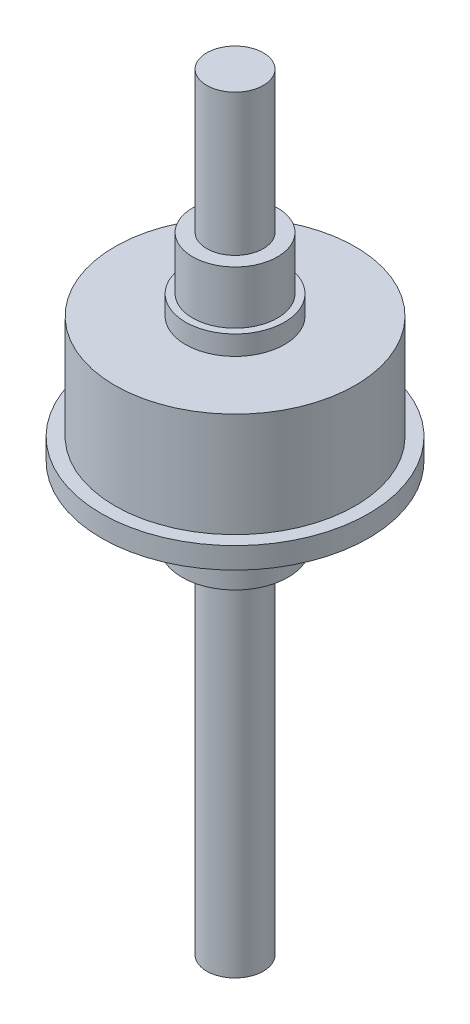
from build123d import *


with BuildPart() as part:
    # Sketch2 → Revolve1 (revolve)
    with BuildSketch(Plane.XY):
        Polygon((0, 0), (-4, 0), (-4, -20), (-6, -20), (-6, -27.5), (-7, -27.5), (-7, -30.25), (-17, -30.25), (-17, -45.01), (-18.9, -45.01), (-18.9, -48.01), (-9, -48.01), (-9, -50.51), (-7.5, -50.51), (-7.5, -58.51), (-4, -58.51), (-4, -108.51), (0, -108.51), align=None)
    revolve(axis=Axis((0, 40.033449689, 0), (0, -1, 0)))


solid = part.part
